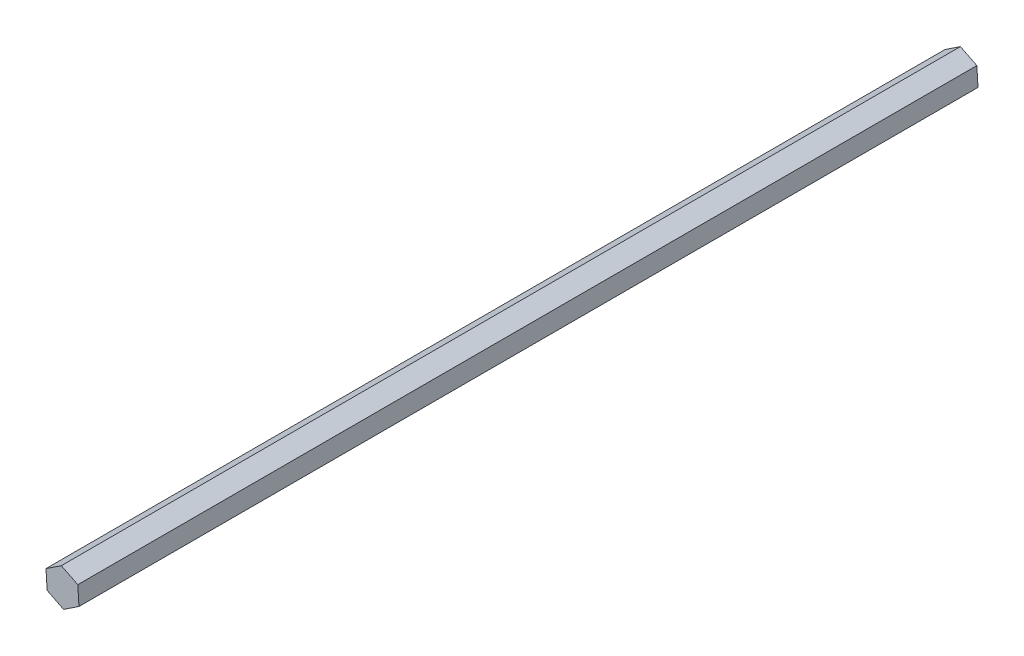
from build123d import *

# Parameters (mm, degrees)
BOSS_EXTRUDE1_DEPTH = 359.1


with BuildPart() as part:
    # Sketch1 → Boss-Extrude1 (new body)
    with BuildSketch(Plane.XY):
        Polygon((-0.45377191, 7.335979216), (-6.580030318, 3.275011606), (-6.126258407, -4.06096761), (0.45377191, -7.335979216), (6.580030318, -3.275011606), (6.126258407, 4.06096761), align=None)
    extrude(amount=BOSS_EXTRUDE1_DEPTH)


solid = part.part
